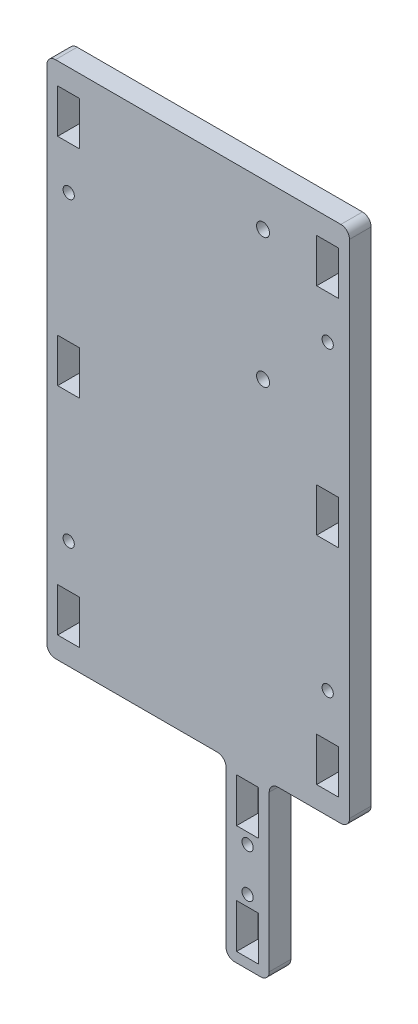
from build123d import *

# Parameters (mm, degrees)
SKETCH1_W           = 6.477
SKETCH1_H           = 12.954
BOSS_EXTRUDE1_DEPTH = 6.35
SKETCH3_W           = 6.477
SKETCH3_H           = 12.827
SKETCH3_R           = 1.651
CUT_EXTRUDE3_DEPTH  = 6.35
SKETCH4_R           = 1.651
CUT_EXTRUDE4_DEPTH  = 6.35
FILLET1_R           = 2.54
SKETCH5_R           = 1.905
CUT_EXTRUDE5_DEPTH  = 6.35


with BuildPart() as part:
    # Sketch1 → Boss-Extrude1 (new body)
    with BuildSketch(Plane.XY):
        Polygon((0, 152.4), (0, 0), (52.613500056, 0), (52.613500056, -50.8), (65.313500056, -50.8), (65.313500056, 0), (88.9, 0), (88.9, 152.4), align=None)
        with Locations((58.963500056, -9.398)):
            Rectangle(SKETCH1_W, SKETCH1_H, mode=Mode.SUBTRACT)
        with Locations((58.963500056, -41.402)):
            Rectangle(SKETCH1_W, SKETCH1_H, mode=Mode.SUBTRACT)
    extrude(amount=BOSS_EXTRUDE1_DEPTH)

    # Sketch3 → Cut-Extrude3 (cut)
    with BuildSketch(Plane.XY.offset(6.35)):
        with Locations((6.4135, 139.6365)):
            Rectangle(SKETCH3_W, SKETCH3_H)
        with Locations((6.4135, 12.7635)):
            Rectangle(SKETCH3_W, SKETCH3_H)
        with Locations((6.4135, 76.2)):
            Rectangle(SKETCH3_W, SKETCH3_H)
        with Locations((82.4865, 76.2)):
            Rectangle(SKETCH3_W, SKETCH3_H)
        with Locations((82.4865, 12.7635)):
            Rectangle(SKETCH3_W, SKETCH3_H)
        with Locations((82.4865, 139.6365)):
            Rectangle(SKETCH3_W, SKETCH3_H)
        with Locations((6.4135, 120.523)):
            Circle(SKETCH3_R)
        with Locations((6.4135, 31.877)):
            Circle(SKETCH3_R)
        with Locations((82.4865, 31.877)):
            Circle(SKETCH3_R)
        with Locations((82.4865, 120.523)):
            Circle(SKETCH3_R)
    extrude(amount=-CUT_EXTRUDE3_DEPTH, mode=Mode.SUBTRACT)

    # Sketch4 → Cut-Extrude4 (cut)
    with BuildSketch(Plane.XY.offset(6.35)):
        with Locations((58.963500056, -19.05)):
            Circle(SKETCH4_R)
        with Locations((58.963500056, -31.75)):
            Circle(SKETCH4_R)
    extrude(amount=-CUT_EXTRUDE4_DEPTH, mode=Mode.SUBTRACT)

    # Fillet1
    fillet1_edges = [part.edges().sort_by_distance(p)[0] for p in [
        (88.9, 152.4, 3.175),
        (88.9, 0, 3.175),
        (65.313500056, 0, 3.175),
        (65.313500056, -50.8, 3.175),
        (52.613500056, -50.8, 3.175),
        (52.613500056, 0, 3.175),
        (0, 0, 3.175),
        (0, 152.4, 3.175),
    ]]
    fillet(fillet1_edges, radius=FILLET1_R)

    # Sketch5 → Cut-Extrude5 (cut)
    with BuildSketch(Plane.XY.offset(6.35)):
        with Locations((63.5, 139.7)):
            Circle(SKETCH5_R)
        with Locations((63.5, 101.6)):
            Circle(SKETCH5_R)
    extrude(amount=-CUT_EXTRUDE5_DEPTH, mode=Mode.SUBTRACT)


solid = part.part
